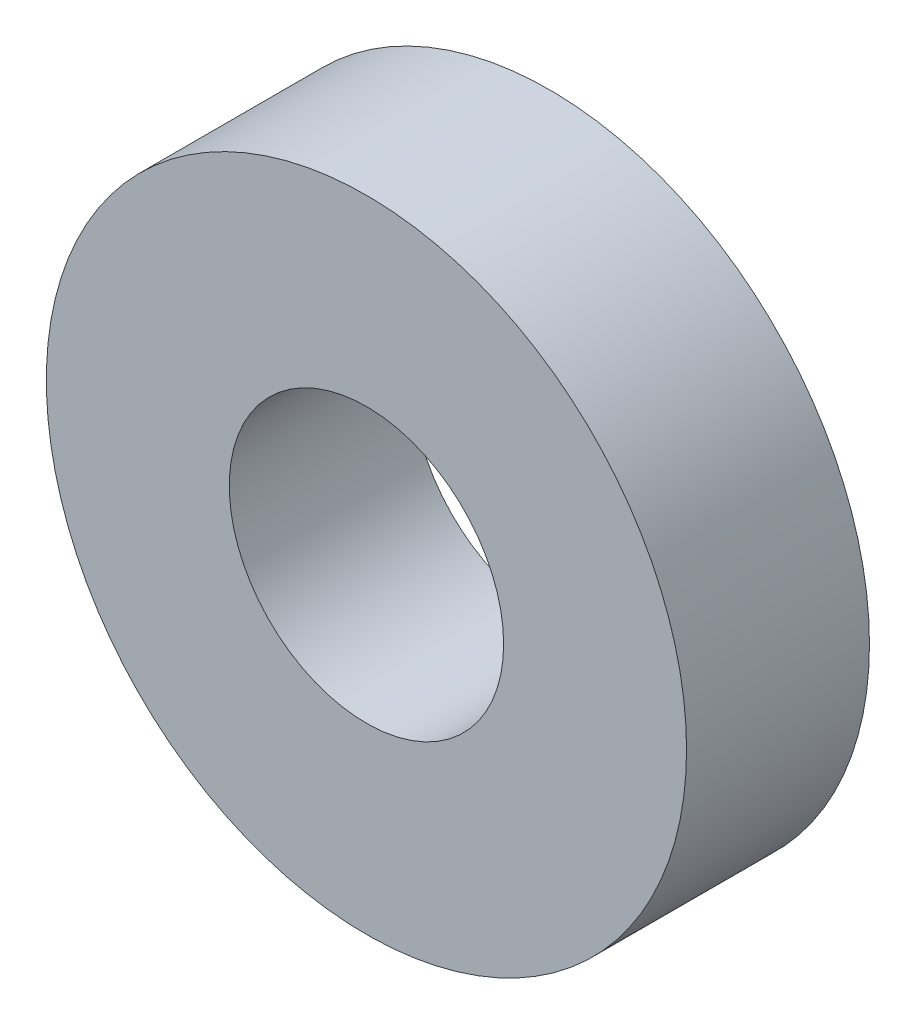
from build123d import *

# Parameters (mm, degrees)
BOSS_EXTRUDE1_DEPTH      = 4
BOSS_EXTRUDE1_DEPTH_BACK = 4
SKETCH1_R                = 14
SKETCH1_R_2              = 6


with BuildPart() as part:
    # Sketch1 → Boss-Extrude1 (new, two sides: drawn at the far end of the back side and taken through both)
    with BuildSketch(Plane.XY.offset(-BOSS_EXTRUDE1_DEPTH_BACK)):
        Circle(SKETCH1_R)
        Circle(SKETCH1_R_2, mode=Mode.SUBTRACT)
    extrude(amount=BOSS_EXTRUDE1_DEPTH + BOSS_EXTRUDE1_DEPTH_BACK)


solid = part.part
